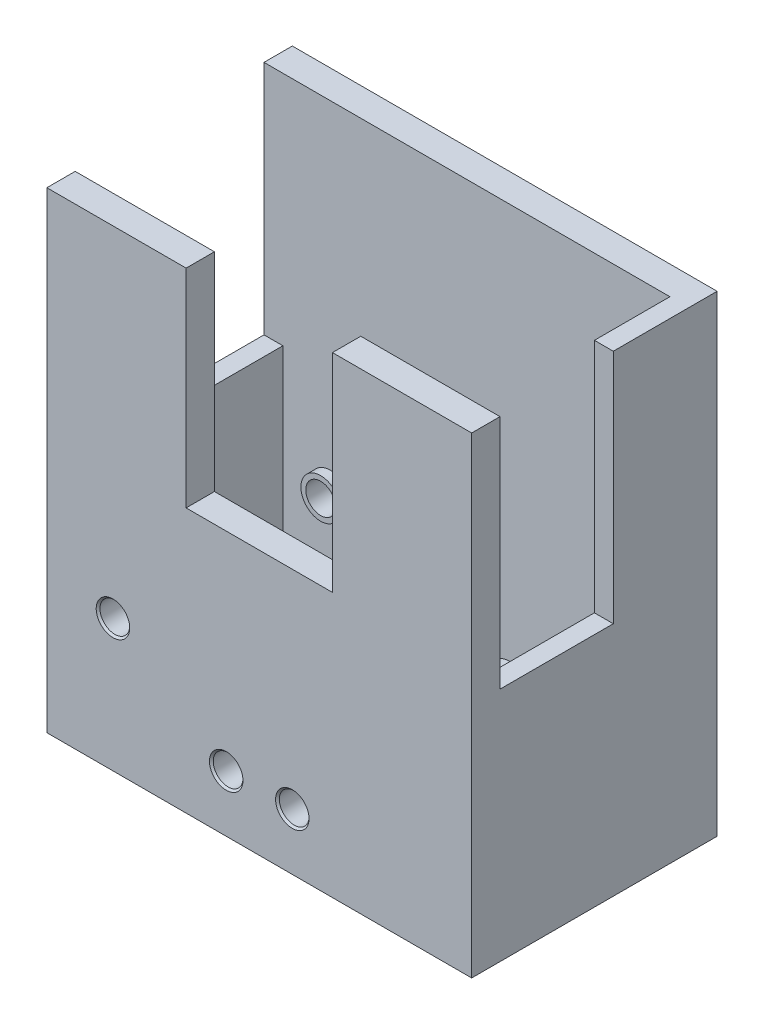
from build123d import *
from build123d.topology import SkipClean

# Parameters (mm, degrees)
SKETCH_1_W                     = 41
SKETCH_1_H                     = 50
EXTRUDE_1_DEPTH                = 3
SKETCH_3_W                     = 15.5
SKETCH_3_H                     = 22
CUT_EXTRUDE_1_DEPTH            = 18
HOLE_WIZARD_M3_5_1_D           = 3.15
HOLE_WIZARD_M3_5_1_CSINK_D     = 3.55
HOLE_WIZARD_M3_5_1_CSINK_ANGLE = 90
SKETCH_16_W                    = 41
SKETCH_16_H                    = 0.872109694
EXTRUDE_5_DEPTH                = 20
SKETCH_17_W                    = 41
SKETCH_17_H                    = 50
SKETCH_17_R                    = 1.575
EXTRUDE_6_DEPTH                = 3
SKETCH_20_W                    = 26
SKETCH_20_H                    = 50
EXTRUDE_8_DEPTH                = 2
SKETCH_21_W                    = 12
SKETCH_21_H                    = 25
CUT_EXTRUDE_2_DEPTH            = 2
SKETCH_22_W                    = 26
SKETCH_22_H                    = 50
EXTRUDE_9_DEPTH                = 2
SKETCH_27_W                    = 20
SKETCH_27_H                    = 25
CUT_EXTRUDE_3_DEPTH            = 2
HOLE_WIZARD_M3_5_2_D           = 2.9
HOLE_WIZARD_M3_5_2_DEPTH       = 10
HOLE_WIZARD_M3_5_2_CSINK_D     = 3.55
HOLE_WIZARD_M3_5_2_CSINK_ANGLE = 90
HOLE_WIZARD_M3_5_2_TIP         = 0.871247898
SKETCH_36_R                    = 2.218303603
SKETCH_36_R_2                  = 1.575
SKETCH_36_R_3                  = 2.18160311
SKETCH_36_R_4                  = 2.164555566
SKETCH_36_R_5                  = 1.714538104
EXTRUDE_10_DEPTH               = 1
EXTRUDE_START                  = 1
SKETCH_37_R                    = 2.094490393
SKETCH_37_R_2                  = 1.575
SKETCH_37_R_3                  = 1.99590809
SKETCH_37_R_4                  = 2.064181582
EXTRUDE_11_DEPTH               = 1
SKETCH_38_R                    = 2.007165216
SKETCH_38_R_2                  = 1.775
SKETCH_38_R_3                  = 2.052187766
SKETCH_38_R_4                  = 2.157504148
SKETCH_38_R_5                  = 2.13214376
EXTRUDE_12_DEPTH               = 0.5


with BuildPart() as part:
    # 스케치1 → 보스-돌출1 (new body)
    with BuildSketch(Plane.XY):
        Rectangle(SKETCH_1_W, SKETCH_1_H)
    extrude(amount=EXTRUDE_1_DEPTH)

    # 스케치3 → 컷-돌출1 (cut)
    with BuildSketch(Plane.XY.offset(3)):
        with Locations((0, 14)):
            Rectangle(SKETCH_3_W, SKETCH_3_H)
    extrude(amount=-CUT_EXTRUDE_1_DEPTH, mode=Mode.SUBTRACT)

    # M3.5 나사 구멍1 (through all)
    with Locations(Plane.XY.offset(3)):
        with Locations((-3.5, -19), (3.5, -19), (-15.5, -11)):
            CounterSinkHole(HOLE_WIZARD_M3_5_1_D / 2, HOLE_WIZARD_M3_5_1_CSINK_D / 2, counter_sink_angle=HOLE_WIZARD_M3_5_1_CSINK_ANGLE)

    # 스케치16 → 보스-돌출5 (add)
    with BuildSketch(Plane(origin=(0, 0, 0), x_dir=(-1, 0, 0), z_dir=(0, 0, -1))):
        with Locations((0, -24.563945153)):
            Rectangle(SKETCH_16_W, SKETCH_16_H)
    extrude(amount=EXTRUDE_5_DEPTH)



with BuildPart() as body_2:
    # 스케치17 → 보스-돌출6 (new body)
    with BuildSketch(Plane(origin=(0, 0, -20), x_dir=(-1, 0, 0), z_dir=(0, 0, -1))):
        Rectangle(SKETCH_17_W, SKETCH_17_H)
        with Locations(Location((15.5, -11, 0), (0, 0, 180))):
            Circle(SKETCH_17_R, mode=Mode.SUBTRACT)
        with Locations(Location((3.5, -19, 0), (0, 0, 180))):
            Circle(SKETCH_17_R, mode=Mode.SUBTRACT)
        with Locations(Location((-3.5, -19, 0), (0, 0, 180))):
            Circle(SKETCH_17_R, mode=Mode.SUBTRACT)
    extrude(amount=EXTRUDE_6_DEPTH)


with BuildPart() as part_1:
    add(part.part)

    add(body_2.part)  # 보스-돌출8 merges body 2
    # 스케치20 → 보스-돌출8 (add)
    with BuildSketch(Plane(origin=(20.5, 0, 0), x_dir=(0, 0, -1), z_dir=(1, 0, 0))):
        with Locations((10, 0)):
            Rectangle(SKETCH_20_W, SKETCH_20_H)
    extrude(amount=EXTRUDE_8_DEPTH)

    # 스케치21 → 컷-돌출2 (cut)
    with BuildSketch(Plane(origin=(22.5, 0, 0), x_dir=(0, 0, -1), z_dir=(1, 0, 0))):
        with Locations((6, 12.5)):
            Rectangle(SKETCH_21_W, SKETCH_21_H)
    extrude(amount=-CUT_EXTRUDE_2_DEPTH, mode=Mode.SUBTRACT)

    # 스케치22 → 보스-돌출9 (add)
    with BuildSketch(Plane.ZY.offset(20.5)):
        with Locations((-10, 0)):
            Rectangle(SKETCH_22_W, SKETCH_22_H)
    extrude(amount=EXTRUDE_9_DEPTH)

    # 스케치27 → 컷-돌출3 (cut)
    with BuildSketch(Plane.ZY.offset(22.5)):
        with Locations((-10, 12.5)):
            Rectangle(SKETCH_27_W, SKETCH_27_H)
    extrude(amount=-CUT_EXTRUDE_3_DEPTH, mode=Mode.SUBTRACT)

    # M3.5 나사 구멍2
    with Locations(Plane(origin=(0, -24.127890306, 0), x_dir=(1, 0, 0), z_dir=(0, 1, 0))):
        with Locations((-18.161355758, 16.900474402), (18.309727807, 16.900474402), (-18.161355758, 2.984453016), (18.309727807, 2.984453016)):
            CounterSinkHole(HOLE_WIZARD_M3_5_2_D / 2, HOLE_WIZARD_M3_5_2_CSINK_D / 2, depth=HOLE_WIZARD_M3_5_2_DEPTH, counter_sink_angle=HOLE_WIZARD_M3_5_2_CSINK_ANGLE)
            with Locations((0, 0, -(HOLE_WIZARD_M3_5_2_DEPTH + HOLE_WIZARD_M3_5_2_TIP / 2))):  # 118° drill point
                Cone(0, HOLE_WIZARD_M3_5_2_D / 2, HOLE_WIZARD_M3_5_2_TIP, mode=Mode.SUBTRACT)

    # 스케치36 → 보스-돌출10 (add)
    # profile 1 of 3: a face of its own
    with SkipClean():  # the faces are left unmerged after this step: merging them gives an invalid solid
        with BuildSketch(Plane(origin=(0, 0, 0), x_dir=(-1, 0, 0), z_dir=(0, 0, -1))):
            with Locations(Location((-3.5, -19, 0), (0, 0, 180))):
                Circle(SKETCH_36_R)
            with Locations(Location((-3.5, -19, 0), (0, 0, 180))):
                Circle(SKETCH_36_R_2, mode=Mode.SUBTRACT)
        # profile 2 of 3: a face of its own
        with BuildSketch(Plane(origin=(0, 0, 0), x_dir=(-1, 0, 0), z_dir=(0, 0, -1))):
            with Locations(Location((3.5, -19, 0), (0, 0, 180))):
                Circle(SKETCH_36_R_3)
            with Locations(Location((3.5, -19, 0), (0, 0, 180))):
                Circle(SKETCH_36_R_2, mode=Mode.SUBTRACT)
        # profile 3 of 3: a face of its own
        with BuildSketch(Plane(origin=(0, 0, 0), x_dir=(-1, 0, 0), z_dir=(0, 0, -1))):
            with Locations(Location((15.5, -11, 0), (0, 0, 180))):
                Circle(SKETCH_36_R_4)
            with Locations(Location((15.5, -10.860461896, 0), (0, 0, 270))):
                Circle(SKETCH_36_R_5, mode=Mode.SUBTRACT)
        extrude(amount=EXTRUDE_10_DEPTH)
    add(part_1.part.scale(1), mode=Mode.REPLACE)  # the faces are merged on a copy

    # 스케치37 → 보스-돌출11 (add)
    # profile 1 of 3: a face of its own
    with BuildSketch(Plane.XY.offset(-20).offset(EXTRUDE_START)):
        with Locations(Location((-15.5, -11, 0), (0, 0, 180))):
            Circle(SKETCH_37_R)
        with Locations((-15.5, -11)):
            Circle(SKETCH_37_R_2, mode=Mode.SUBTRACT)
    # profile 2 of 3: a face of its own
    with BuildSketch(Plane.XY.offset(-20).offset(EXTRUDE_START)):
        with Locations(Location((-3.5, -19, 0), (0, 0, 180))):
            Circle(SKETCH_37_R_3)
        with Locations((-3.5, -19)):
            Circle(SKETCH_37_R_2, mode=Mode.SUBTRACT)
    # profile 3 of 3: a face of its own
    with BuildSketch(Plane.XY.offset(-20).offset(EXTRUDE_START)):
        with Locations(Location((3.5, -19, 0), (0, 0, 180))):
            Circle(SKETCH_37_R_4)
        with Locations((3.5, -19)):
            Circle(SKETCH_37_R_2, mode=Mode.SUBTRACT)
    extrude(amount=-EXTRUDE_11_DEPTH)

    # 스케치38 → 보스-돌출12 (add)
    # profile 1 of 4: a face of its own
    with BuildSketch(Plane(origin=(0, -24.127890306, 0), x_dir=(1, 0, 0), z_dir=(0, 1, 0))):
        with Locations(Location((18.309727807, 16.900474402, 0), (0, 0, 90))):
            Circle(SKETCH_38_R)
        with Locations(Location((18.309727807, 16.900474402, 0), (0, 0, 270))):
            Circle(SKETCH_38_R_2, mode=Mode.SUBTRACT)
    # profile 2 of 4: a face of its own
    with BuildSketch(Plane(origin=(0, -24.127890306, 0), x_dir=(1, 0, 0), z_dir=(0, 1, 0))):
        with Locations(Location((18.309727807, 2.984453016, 0), (0, 0, 90))):
            Circle(SKETCH_38_R_3)
        with Locations(Location((18.309727807, 2.984453016, 0), (0, 0, 270))):
            Circle(SKETCH_38_R_2, mode=Mode.SUBTRACT)
    # profile 3 of 4: a face of its own
    with BuildSketch(Plane(origin=(0, -24.127890306, 0), x_dir=(1, 0, 0), z_dir=(0, 1, 0))):
        with Locations(Location((-18.161355758, 16.900474402, 0), (0, 0, 90))):
            Circle(SKETCH_38_R_4)
        with Locations(Location((-18.161355758, 16.900474402, 0), (0, 0, 270))):
            Circle(SKETCH_38_R_2, mode=Mode.SUBTRACT)
    # profile 4 of 4: a face of its own
    with BuildSketch(Plane(origin=(0, -24.127890306, 0), x_dir=(1, 0, 0), z_dir=(0, 1, 0))):
        with Locations(Location((-18.161355758, 2.984453016, 0), (0, 0, 90))):
            Circle(SKETCH_38_R_5)
        with Locations(Location((-18.161355758, 2.984453016, 0), (0, 0, 270))):
            Circle(SKETCH_38_R_2, mode=Mode.SUBTRACT)
    extrude(amount=EXTRUDE_12_DEPTH)


solid = part_1.part
